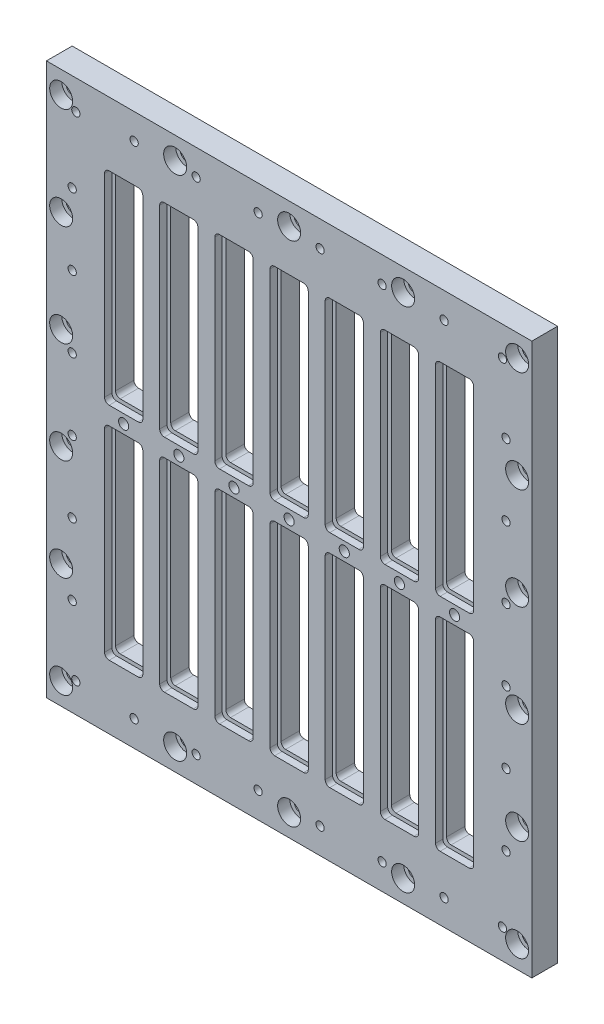
from build123d import *

# Parameters (mm, degrees)
FLANGE_W                         = 167.64
FLANGE_H                         = 190.5
PLATE_DEPTH                      = 8.89
SKETCH3_W                        = 13.208
SKETCH3_H                        = 70.104
RECESS_DEPTH                     = 2.54
SKETCH5_W                        = 10.668
SKETCH5_H                        = 67.564
THRU_HOLE_DEPTH                  = 128.038094287
FILLET2_R                        = 1.5875
FILLET2_OF_MIRROR1_R             = 1.5875
F_6_32_TAPPED_HOLE1_AT_2_COUNT   = 2
F_6_32_TAPPED_HOLE1_AT_2_PITCH   = 211.263499003
CONNECTOR_PAT_DEPTH              = 8.89
CONNECTOR_START                  = 6.35
CONNECTOR_PAT_2_DEPTH            = 2.54
CBORE_D                          = 4.9149
CBORE_CBORE_D                    = 7.9375
CBORE_CBORE_DEPTH                = 4.1656
CBORE_PATTERN_V_COUNT            = 6
CBORE_PATTERN_V_PITCH            = 35.052
CBORE_PATTERN_H_COUNT            = 5
CBORE_PATTERN_H_PITCH            = 39.37
F_4_40_H_PAT_COUNT               = 6
F_4_40_H_PAT_PITCH               = 21.408571429
F_4_40_V_PAT_COUNT               = 6
F_4_40_V_PAT_PITCH               = 24.674285714
F_4_40_TAPPED_CORNERS_AT_2_COUNT = 2
F_4_40_TAPPED_CORNERS_AT_2_PITCH = 170.18
MIRROR2_COPY_1_D                 = 4.9149
MIRROR2_COPY_1_CBORE_D           = 7.9375
MIRROR2_COPY_1_CBORE_DEPTH       = 4.1656
MIRROR2_COPY_2_D                 = 4.9149
MIRROR2_COPY_2_CBORE_D           = 7.9375
MIRROR2_COPY_2_CBORE_DEPTH       = 4.1656
MIRROR2_COPY_3_D                 = 4.9149
MIRROR2_COPY_3_CBORE_D           = 7.9375
MIRROR2_COPY_3_CBORE_DEPTH       = 4.1656
MIRROR2_COPY_4_D                 = 4.9149
MIRROR2_COPY_4_CBORE_D           = 7.9375
MIRROR2_COPY_4_CBORE_DEPTH       = 4.1656
MIRROR2_COPY_5_D                 = 4.9149
MIRROR2_COPY_5_CBORE_D           = 7.9375
MIRROR2_COPY_5_CBORE_DEPTH       = 4.1656
MIRROR3_COPY_1_D                 = 4.9149
MIRROR3_COPY_1_CBORE_D           = 7.9375
MIRROR3_COPY_1_CBORE_DEPTH       = 4.1656
MIRROR3_COPY_2_D                 = 4.9149
MIRROR3_COPY_2_CBORE_D           = 7.9375
MIRROR3_COPY_2_CBORE_DEPTH       = 4.1656
MIRROR3_COPY_3_D                 = 4.9149
MIRROR3_COPY_3_CBORE_D           = 7.9375
MIRROR3_COPY_3_CBORE_DEPTH       = 4.1656
MIRROR3_COPY_4_D                 = 4.9149
MIRROR3_COPY_4_CBORE_D           = 7.9375
MIRROR3_COPY_4_CBORE_DEPTH       = 4.1656
MIRROR3_COPY_5_D                 = 4.9149
MIRROR3_COPY_5_CBORE_D           = 7.9375
MIRROR3_COPY_5_CBORE_DEPTH       = 4.1656
MIRROR3_COPY_6_D                 = 4.9149
MIRROR3_COPY_6_CBORE_D           = 7.9375
MIRROR3_COPY_6_CBORE_DEPTH       = 4.1656
ORING_RECESS_DEPTH               = 2.6416
RF_W                             = 148.9964
RF_H                             = 170.7896
RF_RECESS_DEPTH                  = 1.1938


# Read off the part's stored shape, not the designer's step: connector pat
with BuildPart() as part:
    # flange → plate (new body)
    with BuildSketch(Plane.XY):
        Rectangle(FLANGE_W, FLANGE_H)
    extrude(amount=PLATE_DEPTH)

    # Sketch3 → recess (cut)
    with BuildSketch(Plane.XY.offset(8.89)):
        with Locations((0, -38.1381)):
            Rectangle(SKETCH3_W, SKETCH3_H)
    recess = extrude(amount=-RECESS_DEPTH, mode=Mode.SUBTRACT)

    # Sketch5 → thru hole (cut, through all)
    with BuildSketch(Plane.XY.offset(6.35)):
        with Locations((0, -38.1381)):
            Rectangle(SKETCH5_W, SKETCH5_H)
    thru_hole = extrude(amount=-THRU_HOLE_DEPTH, mode=Mode.SUBTRACT)

    # Fillet2
    fillet2_edges = [part.edges().sort_by_distance(p)[0] for p in [
        (-6.604, -73.1901, 7.62),
        (-6.604, -3.0861, 7.62),
        (6.604, -3.0861, 7.62),
        (6.604, -73.1901, 7.62),
        (-5.334, -4.3561, 3.175),
        (5.334, -4.3561, 3.175),
        (5.334, -71.9201, 3.175),
        (-5.334, -71.9201, 3.175),
    ]]
    fillet(fillet2_edges, radius=FILLET2_R)

    # Mirror1: recess, thru hole across plane
    add(recess.mirror(Plane.ZX), mode=Mode.SUBTRACT)
    add(thru_hole.mirror(Plane.ZX), mode=Mode.SUBTRACT)

    # Fillet2 of Mirror1
    fillet2_of_mirror1_edges = [part.edges().sort_by_distance(p)[0] for p in [
        (-6.604, 73.1901, 7.62),
        (-6.604, 3.0861, 7.62),
        (6.604, 3.0861, 7.62),
        (6.604, 73.1901, 7.62),
        (-5.334, 4.3561, 3.175),
        (5.334, 4.3561, 3.175),
        (5.334, 71.9201, 3.175),
        (-5.334, 71.9201, 3.175),
    ]]
    fillet(fillet2_of_mirror1_edges, radius=FILLET2_OF_MIRROR1_R)

    # Sketch10 → #6-32 Tapped Hole1 (revolve, cut)
    with BuildSketch(Plane(origin=(0, 0, 8.89), x_dir=(0, -1, 0), z_dir=(1, 0, 0))):
        Polygon((0, 0), (0, 7.16269403), (1.35255, 6.35), (1.35255, 5.08), (1.7526, 5.08), (1.7526, 0), align=None)
    f_6_32_tapped_hole1 = revolve(axis=Axis((0, 0, 15.24), (0, 0, -1)), mode=Mode.SUBTRACT)

    # #6-32 Tapped Hole1 at 2: #6-32 Tapped Hole1 ×2
    with Locations(*[Vector(-0.9956457663100188, -0.09321753069533449, 0) * (i * F_6_32_TAPPED_HOLE1_AT_2_PITCH) for i in range(1, F_6_32_TAPPED_HOLE1_AT_2_COUNT)]):
        add(f_6_32_tapped_hole1, mode=Mode.SUBTRACT)

    # connector pat outline → connector pat (cut)
    with BuildSketch(Plane.XY):
        with BuildLine():
            ThreePointArc((-13.716, -5.9436), (-14.180967985, -4.821067985), (-15.3035, -4.3561))
            Line((-15.3035, -4.3561), (-22.7965, -4.3561))
            ThreePointArc((-22.7965, -4.3561), (-23.919032015, -4.821067985), (-24.384, -5.9436))
            Line((-24.384, -5.9436), (-24.384, -70.3326))
            ThreePointArc((-24.384, -70.3326), (-23.919032015, -71.455132015), (-22.7965, -71.9201))
            Line((-22.7965, -71.9201), (-15.3035, -71.9201))
            ThreePointArc((-15.3035, -71.9201), (-14.180967985, -71.455132015), (-13.716, -70.3326))
            Line((-13.716, -70.3326), (-13.716, -5.9436))
        make_face()
        with BuildLine():
            ThreePointArc((-32.766, -5.9436), (-33.230967985, -4.821067985), (-34.3535, -4.3561))
            Line((-34.3535, -4.3561), (-41.8465, -4.3561))
            ThreePointArc((-41.8465, -4.3561), (-42.969032015, -4.821067985), (-43.434, -5.9436))
            Line((-43.434, -5.9436), (-43.434, -70.3326))
            ThreePointArc((-43.434, -70.3326), (-42.969032015, -71.455132015), (-41.8465, -71.9201))
            Line((-41.8465, -71.9201), (-34.3535, -71.9201))
            ThreePointArc((-34.3535, -71.9201), (-33.230967985, -71.455132015), (-32.766, -70.3326))
            Line((-32.766, -70.3326), (-32.766, -5.9436))
        make_face()
        with BuildLine():
            ThreePointArc((-51.816, -5.9436), (-52.280967985, -4.821067985), (-53.4035, -4.3561))
            Line((-53.4035, -4.3561), (-60.8965, -4.3561))
            ThreePointArc((-60.8965, -4.3561), (-62.019032015, -4.821067985), (-62.484, -5.9436))
            Line((-62.484, -5.9436), (-62.484, -70.3326))
            ThreePointArc((-62.484, -70.3326), (-62.019032015, -71.455132015), (-60.8965, -71.9201))
            Line((-60.8965, -71.9201), (-53.4035, -71.9201))
            ThreePointArc((-53.4035, -71.9201), (-52.280967985, -71.455132015), (-51.816, -70.3326))
            Line((-51.816, -70.3326), (-51.816, -5.9436))
        make_face()
        with BuildLine():
            ThreePointArc((24.384, -5.9436), (23.919032015, -4.821067985), (22.7965, -4.3561))
            Line((22.7965, -4.3561), (15.3035, -4.3561))
            ThreePointArc((15.3035, -4.3561), (14.180967985, -4.821067985), (13.716, -5.9436))
            Line((13.716, -5.9436), (13.716, -70.3326))
            ThreePointArc((13.716, -70.3326), (14.180967985, -71.455132015), (15.3035, -71.9201))
            Line((15.3035, -71.9201), (22.7965, -71.9201))
            ThreePointArc((22.7965, -71.9201), (23.919032015, -71.455132015), (24.384, -70.3326))
            Line((24.384, -70.3326), (24.384, -5.9436))
        make_face()
        with BuildLine():
            ThreePointArc((43.434, -5.9436), (42.969032015, -4.821067985), (41.8465, -4.3561))
            Line((41.8465, -4.3561), (34.3535, -4.3561))
            ThreePointArc((34.3535, -4.3561), (33.230967985, -4.821067985), (32.766, -5.9436))
            Line((32.766, -5.9436), (32.766, -70.3326))
            ThreePointArc((32.766, -70.3326), (33.230967985, -71.455132015), (34.3535, -71.9201))
            Line((34.3535, -71.9201), (41.8465, -71.9201))
            ThreePointArc((41.8465, -71.9201), (42.969032015, -71.455132015), (43.434, -70.3326))
            Line((43.434, -70.3326), (43.434, -5.9436))
        make_face()
        with BuildLine():
            ThreePointArc((62.484, -5.9436), (62.019032015, -4.821067985), (60.8965, -4.3561))
            Line((60.8965, -4.3561), (53.4035, -4.3561))
            ThreePointArc((53.4035, -4.3561), (52.280967985, -4.821067985), (51.816, -5.9436))
            Line((51.816, -5.9436), (51.816, -70.3326))
            ThreePointArc((51.816, -70.3326), (52.280967985, -71.455132015), (53.4035, -71.9201))
            Line((53.4035, -71.9201), (60.8965, -71.9201))
            ThreePointArc((60.8965, -71.9201), (62.019032015, -71.455132015), (62.484, -70.3326))
            Line((62.484, -70.3326), (62.484, -5.9436))
        make_face()
        with BuildLine():
            ThreePointArc((-13.716, 70.3326), (-14.180967985, 71.455132015), (-15.3035, 71.9201))
            Line((-15.3035, 71.9201), (-22.7965, 71.9201))
            ThreePointArc((-22.7965, 71.9201), (-23.919032015, 71.455132015), (-24.384, 70.3326))
            Line((-24.384, 70.3326), (-24.384, 5.9436))
            ThreePointArc((-24.384, 5.9436), (-23.919032015, 4.821067985), (-22.7965, 4.3561))
            Line((-22.7965, 4.3561), (-15.3035, 4.3561))
            ThreePointArc((-15.3035, 4.3561), (-14.180967985, 4.821067985), (-13.716, 5.9436))
            Line((-13.716, 5.9436), (-13.716, 70.3326))
        make_face()
        with BuildLine():
            ThreePointArc((-32.766, 70.3326), (-33.230967985, 71.455132015), (-34.3535, 71.9201))
            Line((-34.3535, 71.9201), (-41.8465, 71.9201))
            ThreePointArc((-41.8465, 71.9201), (-42.969032015, 71.455132015), (-43.434, 70.3326))
            Line((-43.434, 70.3326), (-43.434, 5.9436))
            ThreePointArc((-43.434, 5.9436), (-42.969032015, 4.821067985), (-41.8465, 4.3561))
            Line((-41.8465, 4.3561), (-34.3535, 4.3561))
            ThreePointArc((-34.3535, 4.3561), (-33.230967985, 4.821067985), (-32.766, 5.9436))
            Line((-32.766, 5.9436), (-32.766, 70.3326))
        make_face()
        with BuildLine():
            ThreePointArc((-51.816, 70.3326), (-52.280967985, 71.455132015), (-53.4035, 71.9201))
            Line((-53.4035, 71.9201), (-60.8965, 71.9201))
            ThreePointArc((-60.8965, 71.9201), (-62.019032015, 71.455132015), (-62.484, 70.3326))
            Line((-62.484, 70.3326), (-62.484, 5.9436))
            ThreePointArc((-62.484, 5.9436), (-62.019032015, 4.821067985), (-60.8965, 4.3561))
            Line((-60.8965, 4.3561), (-53.4035, 4.3561))
            ThreePointArc((-53.4035, 4.3561), (-52.280967985, 4.821067985), (-51.816, 5.9436))
            Line((-51.816, 5.9436), (-51.816, 70.3326))
        make_face()
        with BuildLine():
            ThreePointArc((24.384, 70.3326), (23.919032015, 71.455132015), (22.7965, 71.9201))
            Line((22.7965, 71.9201), (15.3035, 71.9201))
            ThreePointArc((15.3035, 71.9201), (14.180967985, 71.455132015), (13.716, 70.3326))
            Line((13.716, 70.3326), (13.716, 5.9436))
            ThreePointArc((13.716, 5.9436), (14.180967985, 4.821067985), (15.3035, 4.3561))
            Line((15.3035, 4.3561), (22.7965, 4.3561))
            ThreePointArc((22.7965, 4.3561), (23.919032015, 4.821067985), (24.384, 5.9436))
            Line((24.384, 5.9436), (24.384, 70.3326))
        make_face()
        with BuildLine():
            ThreePointArc((43.434, 70.3326), (42.969032015, 71.455132015), (41.8465, 71.9201))
            Line((41.8465, 71.9201), (34.3535, 71.9201))
            ThreePointArc((34.3535, 71.9201), (33.230967985, 71.455132015), (32.766, 70.3326))
            Line((32.766, 70.3326), (32.766, 5.9436))
            ThreePointArc((32.766, 5.9436), (33.230967985, 4.821067985), (34.3535, 4.3561))
            Line((34.3535, 4.3561), (41.8465, 4.3561))
            ThreePointArc((41.8465, 4.3561), (42.969032015, 4.821067985), (43.434, 5.9436))
            Line((43.434, 5.9436), (43.434, 70.3326))
        make_face()
        with BuildLine():
            ThreePointArc((62.484, 70.3326), (62.019032015, 71.455132015), (60.8965, 71.9201))
            Line((60.8965, 71.9201), (53.4035, 71.9201))
            ThreePointArc((53.4035, 71.9201), (52.280967985, 71.455132015), (51.816, 70.3326))
            Line((51.816, 70.3326), (51.816, 5.9436))
            ThreePointArc((51.816, 5.9436), (52.280967985, 4.821067985), (53.4035, 4.3561))
            Line((53.4035, 4.3561), (60.8965, 4.3561))
            ThreePointArc((60.8965, 4.3561), (62.019032015, 4.821067985), (62.484, 5.9436))
            Line((62.484, 5.9436), (62.484, 70.3326))
        make_face()
    extrude(amount=CONNECTOR_PAT_DEPTH, mode=Mode.SUBTRACT)

    # connector pat 2 outline → connector pat 2 (cut)
    # profile 1 of 12: a face of its own
    with BuildSketch(Plane.XY.offset(CONNECTOR_START)):
        with BuildLine():
            ThreePointArc((-12.446, -4.6736), (-12.910967985, -3.551067985), (-14.0335, -3.0861))
            Line((-14.0335, -3.0861), (-24.0665, -3.0861))
            ThreePointArc((-24.0665, -3.0861), (-25.189032015, -3.551067985), (-25.654, -4.6736))
            Line((-25.654, -4.6736), (-25.654, -71.6026))
            ThreePointArc((-25.654, -71.6026), (-25.189032015, -72.725132015), (-24.0665, -73.1901))
            Line((-24.0665, -73.1901), (-14.0335, -73.1901))
            ThreePointArc((-14.0335, -73.1901), (-12.910967985, -72.725132015), (-12.446, -71.6026))
            Line((-12.446, -71.6026), (-12.446, -4.6736))
        make_face()
        with BuildLine():
            Line((-22.7965, -4.3561), (-15.3035, -4.3561))
            ThreePointArc((-15.3035, -4.3561), (-14.180967985, -4.821067985), (-13.716, -5.9436))
            Line((-13.716, -5.9436), (-13.716, -70.3326))
            ThreePointArc((-13.716, -70.3326), (-14.180967985, -71.455132015), (-15.3035, -71.9201))
            Line((-15.3035, -71.9201), (-22.7965, -71.9201))
            ThreePointArc((-22.7965, -71.9201), (-23.919032015, -71.455132015), (-24.384, -70.3326))
            Line((-24.384, -70.3326), (-24.384, -5.9436))
            ThreePointArc((-24.384, -5.9436), (-23.919032015, -4.821067985), (-22.7965, -4.3561))
        make_face(mode=Mode.SUBTRACT)
    # profile 2 of 12: a face of its own
    with BuildSketch(Plane.XY.offset(CONNECTOR_START)):
        with BuildLine():
            ThreePointArc((-31.496, -4.6736), (-31.960967985, -3.551067985), (-33.0835, -3.0861))
            Line((-33.0835, -3.0861), (-43.1165, -3.0861))
            ThreePointArc((-43.1165, -3.0861), (-44.239032015, -3.551067985), (-44.704, -4.6736))
            Line((-44.704, -4.6736), (-44.704, -71.6026))
            ThreePointArc((-44.704, -71.6026), (-44.239032015, -72.725132015), (-43.1165, -73.1901))
            Line((-43.1165, -73.1901), (-33.0835, -73.1901))
            ThreePointArc((-33.0835, -73.1901), (-31.960967985, -72.725132015), (-31.496, -71.6026))
            Line((-31.496, -71.6026), (-31.496, -4.6736))
        make_face()
        with BuildLine():
            Line((-41.8465, -4.3561), (-34.3535, -4.3561))
            ThreePointArc((-34.3535, -4.3561), (-33.230967985, -4.821067985), (-32.766, -5.9436))
            Line((-32.766, -5.9436), (-32.766, -70.3326))
            ThreePointArc((-32.766, -70.3326), (-33.230967985, -71.455132015), (-34.3535, -71.9201))
            Line((-34.3535, -71.9201), (-41.8465, -71.9201))
            ThreePointArc((-41.8465, -71.9201), (-42.969032015, -71.455132015), (-43.434, -70.3326))
            Line((-43.434, -70.3326), (-43.434, -5.9436))
            ThreePointArc((-43.434, -5.9436), (-42.969032015, -4.821067985), (-41.8465, -4.3561))
        make_face(mode=Mode.SUBTRACT)
    # profile 3 of 12: a face of its own
    with BuildSketch(Plane.XY.offset(CONNECTOR_START)):
        with BuildLine():
            ThreePointArc((-50.546, -4.6736), (-51.010967985, -3.551067985), (-52.1335, -3.0861))
            Line((-52.1335, -3.0861), (-62.1665, -3.0861))
            ThreePointArc((-62.1665, -3.0861), (-63.289032015, -3.551067985), (-63.754, -4.6736))
            Line((-63.754, -4.6736), (-63.754, -71.6026))
            ThreePointArc((-63.754, -71.6026), (-63.289032015, -72.725132015), (-62.1665, -73.1901))
            Line((-62.1665, -73.1901), (-52.1335, -73.1901))
            ThreePointArc((-52.1335, -73.1901), (-51.010967985, -72.725132015), (-50.546, -71.6026))
            Line((-50.546, -71.6026), (-50.546, -4.6736))
        make_face()
        with BuildLine():
            Line((-60.8965, -4.3561), (-53.4035, -4.3561))
            ThreePointArc((-53.4035, -4.3561), (-52.280967985, -4.821067985), (-51.816, -5.9436))
            Line((-51.816, -5.9436), (-51.816, -70.3326))
            ThreePointArc((-51.816, -70.3326), (-52.280967985, -71.455132015), (-53.4035, -71.9201))
            Line((-53.4035, -71.9201), (-60.8965, -71.9201))
            ThreePointArc((-60.8965, -71.9201), (-62.019032015, -71.455132015), (-62.484, -70.3326))
            Line((-62.484, -70.3326), (-62.484, -5.9436))
            ThreePointArc((-62.484, -5.9436), (-62.019032015, -4.821067985), (-60.8965, -4.3561))
        make_face(mode=Mode.SUBTRACT)
    # profile 4 of 12: a face of its own
    with BuildSketch(Plane.XY.offset(CONNECTOR_START)):
        with BuildLine():
            ThreePointArc((25.654, -4.6736), (25.189032015, -3.551067985), (24.0665, -3.0861))
            Line((24.0665, -3.0861), (14.0335, -3.0861))
            ThreePointArc((14.0335, -3.0861), (12.910967985, -3.551067985), (12.446, -4.6736))
            Line((12.446, -4.6736), (12.446, -71.6026))
            ThreePointArc((12.446, -71.6026), (12.910967985, -72.725132015), (14.0335, -73.1901))
            Line((14.0335, -73.1901), (24.0665, -73.1901))
            ThreePointArc((24.0665, -73.1901), (25.189032015, -72.725132015), (25.654, -71.6026))
            Line((25.654, -71.6026), (25.654, -4.6736))
        make_face()
        with BuildLine():
            Line((15.3035, -4.3561), (22.7965, -4.3561))
            ThreePointArc((22.7965, -4.3561), (23.919032015, -4.821067985), (24.384, -5.9436))
            Line((24.384, -5.9436), (24.384, -70.3326))
            ThreePointArc((24.384, -70.3326), (23.919032015, -71.455132015), (22.7965, -71.9201))
            Line((22.7965, -71.9201), (15.3035, -71.9201))
            ThreePointArc((15.3035, -71.9201), (14.180967985, -71.455132015), (13.716, -70.3326))
            Line((13.716, -70.3326), (13.716, -5.9436))
            ThreePointArc((13.716, -5.9436), (14.180967985, -4.821067985), (15.3035, -4.3561))
        make_face(mode=Mode.SUBTRACT)
    # profile 5 of 12: a face of its own
    with BuildSketch(Plane.XY.offset(CONNECTOR_START)):
        with BuildLine():
            ThreePointArc((44.704, -4.6736), (44.239032015, -3.551067985), (43.1165, -3.0861))
            Line((43.1165, -3.0861), (33.0835, -3.0861))
            ThreePointArc((33.0835, -3.0861), (31.960967985, -3.551067985), (31.496, -4.6736))
            Line((31.496, -4.6736), (31.496, -71.6026))
            ThreePointArc((31.496, -71.6026), (31.960967985, -72.725132015), (33.0835, -73.1901))
            Line((33.0835, -73.1901), (43.1165, -73.1901))
            ThreePointArc((43.1165, -73.1901), (44.239032015, -72.725132015), (44.704, -71.6026))
            Line((44.704, -71.6026), (44.704, -4.6736))
        make_face()
        with BuildLine():
            Line((34.3535, -4.3561), (41.8465, -4.3561))
            ThreePointArc((41.8465, -4.3561), (42.969032015, -4.821067985), (43.434, -5.9436))
            Line((43.434, -5.9436), (43.434, -70.3326))
            ThreePointArc((43.434, -70.3326), (42.969032015, -71.455132015), (41.8465, -71.9201))
            Line((41.8465, -71.9201), (34.3535, -71.9201))
            ThreePointArc((34.3535, -71.9201), (33.230967985, -71.455132015), (32.766, -70.3326))
            Line((32.766, -70.3326), (32.766, -5.9436))
            ThreePointArc((32.766, -5.9436), (33.230967985, -4.821067985), (34.3535, -4.3561))
        make_face(mode=Mode.SUBTRACT)
    # profile 6 of 12: a face of its own
    with BuildSketch(Plane.XY.offset(CONNECTOR_START)):
        with BuildLine():
            ThreePointArc((63.754, -4.6736), (63.289032015, -3.551067985), (62.1665, -3.0861))
            Line((62.1665, -3.0861), (52.1335, -3.0861))
            ThreePointArc((52.1335, -3.0861), (51.010967985, -3.551067985), (50.546, -4.6736))
            Line((50.546, -4.6736), (50.546, -71.6026))
            ThreePointArc((50.546, -71.6026), (51.010967985, -72.725132015), (52.1335, -73.1901))
            Line((52.1335, -73.1901), (62.1665, -73.1901))
            ThreePointArc((62.1665, -73.1901), (63.289032015, -72.725132015), (63.754, -71.6026))
            Line((63.754, -71.6026), (63.754, -4.6736))
        make_face()
        with BuildLine():
            Line((53.4035, -4.3561), (60.8965, -4.3561))
            ThreePointArc((60.8965, -4.3561), (62.019032015, -4.821067985), (62.484, -5.9436))
            Line((62.484, -5.9436), (62.484, -70.3326))
            ThreePointArc((62.484, -70.3326), (62.019032015, -71.455132015), (60.8965, -71.9201))
            Line((60.8965, -71.9201), (53.4035, -71.9201))
            ThreePointArc((53.4035, -71.9201), (52.280967985, -71.455132015), (51.816, -70.3326))
            Line((51.816, -70.3326), (51.816, -5.9436))
            ThreePointArc((51.816, -5.9436), (52.280967985, -4.821067985), (53.4035, -4.3561))
        make_face(mode=Mode.SUBTRACT)
    # profile 7 of 12: a face of its own
    with BuildSketch(Plane.XY.offset(CONNECTOR_START)):
        with BuildLine():
            ThreePointArc((-12.446, 71.6026), (-12.910967985, 72.725132015), (-14.0335, 73.1901))
            Line((-14.0335, 73.1901), (-24.0665, 73.1901))
            ThreePointArc((-24.0665, 73.1901), (-25.189032015, 72.725132015), (-25.654, 71.6026))
            Line((-25.654, 71.6026), (-25.654, 4.6736))
            ThreePointArc((-25.654, 4.6736), (-25.189032015, 3.551067985), (-24.0665, 3.0861))
            Line((-24.0665, 3.0861), (-14.0335, 3.0861))
            ThreePointArc((-14.0335, 3.0861), (-12.910967985, 3.551067985), (-12.446, 4.6736))
            Line((-12.446, 4.6736), (-12.446, 71.6026))
        make_face()
        with BuildLine():
            Line((-22.7965, 71.9201), (-15.3035, 71.9201))
            ThreePointArc((-15.3035, 71.9201), (-14.180967985, 71.455132015), (-13.716, 70.3326))
            Line((-13.716, 70.3326), (-13.716, 5.9436))
            ThreePointArc((-13.716, 5.9436), (-14.180967985, 4.821067985), (-15.3035, 4.3561))
            Line((-15.3035, 4.3561), (-22.7965, 4.3561))
            ThreePointArc((-22.7965, 4.3561), (-23.919032015, 4.821067985), (-24.384, 5.9436))
            Line((-24.384, 5.9436), (-24.384, 70.3326))
            ThreePointArc((-24.384, 70.3326), (-23.919032015, 71.455132015), (-22.7965, 71.9201))
        make_face(mode=Mode.SUBTRACT)
    # profile 8 of 12: a face of its own
    with BuildSketch(Plane.XY.offset(CONNECTOR_START)):
        with BuildLine():
            ThreePointArc((-31.496, 71.6026), (-31.960967985, 72.725132015), (-33.0835, 73.1901))
            Line((-33.0835, 73.1901), (-43.1165, 73.1901))
            ThreePointArc((-43.1165, 73.1901), (-44.239032015, 72.725132015), (-44.704, 71.6026))
            Line((-44.704, 71.6026), (-44.704, 4.6736))
            ThreePointArc((-44.704, 4.6736), (-44.239032015, 3.551067985), (-43.1165, 3.0861))
            Line((-43.1165, 3.0861), (-33.0835, 3.0861))
            ThreePointArc((-33.0835, 3.0861), (-31.960967985, 3.551067985), (-31.496, 4.6736))
            Line((-31.496, 4.6736), (-31.496, 71.6026))
        make_face()
        with BuildLine():
            Line((-41.8465, 71.9201), (-34.3535, 71.9201))
            ThreePointArc((-34.3535, 71.9201), (-33.230967985, 71.455132015), (-32.766, 70.3326))
            Line((-32.766, 70.3326), (-32.766, 5.9436))
            ThreePointArc((-32.766, 5.9436), (-33.230967985, 4.821067985), (-34.3535, 4.3561))
            Line((-34.3535, 4.3561), (-41.8465, 4.3561))
            ThreePointArc((-41.8465, 4.3561), (-42.969032015, 4.821067985), (-43.434, 5.9436))
            Line((-43.434, 5.9436), (-43.434, 70.3326))
            ThreePointArc((-43.434, 70.3326), (-42.969032015, 71.455132015), (-41.8465, 71.9201))
        make_face(mode=Mode.SUBTRACT)
    # profile 9 of 12: a face of its own
    with BuildSketch(Plane.XY.offset(CONNECTOR_START)):
        with BuildLine():
            ThreePointArc((-50.546, 71.6026), (-51.010967985, 72.725132015), (-52.1335, 73.1901))
            Line((-52.1335, 73.1901), (-62.1665, 73.1901))
            ThreePointArc((-62.1665, 73.1901), (-63.289032015, 72.725132015), (-63.754, 71.6026))
            Line((-63.754, 71.6026), (-63.754, 4.6736))
            ThreePointArc((-63.754, 4.6736), (-63.289032015, 3.551067985), (-62.1665, 3.0861))
            Line((-62.1665, 3.0861), (-52.1335, 3.0861))
            ThreePointArc((-52.1335, 3.0861), (-51.010967985, 3.551067985), (-50.546, 4.6736))
            Line((-50.546, 4.6736), (-50.546, 71.6026))
        make_face()
        with BuildLine():
            Line((-60.8965, 71.9201), (-53.4035, 71.9201))
            ThreePointArc((-53.4035, 71.9201), (-52.280967985, 71.455132015), (-51.816, 70.3326))
            Line((-51.816, 70.3326), (-51.816, 5.9436))
            ThreePointArc((-51.816, 5.9436), (-52.280967985, 4.821067985), (-53.4035, 4.3561))
            Line((-53.4035, 4.3561), (-60.8965, 4.3561))
            ThreePointArc((-60.8965, 4.3561), (-62.019032015, 4.821067985), (-62.484, 5.9436))
            Line((-62.484, 5.9436), (-62.484, 70.3326))
            ThreePointArc((-62.484, 70.3326), (-62.019032015, 71.455132015), (-60.8965, 71.9201))
        make_face(mode=Mode.SUBTRACT)
    # profile 10 of 12: a face of its own
    with BuildSketch(Plane.XY.offset(CONNECTOR_START)):
        with BuildLine():
            ThreePointArc((25.654, 71.6026), (25.189032015, 72.725132015), (24.0665, 73.1901))
            Line((24.0665, 73.1901), (14.0335, 73.1901))
            ThreePointArc((14.0335, 73.1901), (12.910967985, 72.725132015), (12.446, 71.6026))
            Line((12.446, 71.6026), (12.446, 4.6736))
            ThreePointArc((12.446, 4.6736), (12.910967985, 3.551067985), (14.0335, 3.0861))
            Line((14.0335, 3.0861), (24.0665, 3.0861))
            ThreePointArc((24.0665, 3.0861), (25.189032015, 3.551067985), (25.654, 4.6736))
            Line((25.654, 4.6736), (25.654, 71.6026))
        make_face()
        with BuildLine():
            Line((15.3035, 71.9201), (22.7965, 71.9201))
            ThreePointArc((22.7965, 71.9201), (23.919032015, 71.455132015), (24.384, 70.3326))
            Line((24.384, 70.3326), (24.384, 5.9436))
            ThreePointArc((24.384, 5.9436), (23.919032015, 4.821067985), (22.7965, 4.3561))
            Line((22.7965, 4.3561), (15.3035, 4.3561))
            ThreePointArc((15.3035, 4.3561), (14.180967985, 4.821067985), (13.716, 5.9436))
            Line((13.716, 5.9436), (13.716, 70.3326))
            ThreePointArc((13.716, 70.3326), (14.180967985, 71.455132015), (15.3035, 71.9201))
        make_face(mode=Mode.SUBTRACT)
    # profile 11 of 12: a face of its own
    with BuildSketch(Plane.XY.offset(CONNECTOR_START)):
        with BuildLine():
            ThreePointArc((44.704, 71.6026), (44.239032015, 72.725132015), (43.1165, 73.1901))
            Line((43.1165, 73.1901), (33.0835, 73.1901))
            ThreePointArc((33.0835, 73.1901), (31.960967985, 72.725132015), (31.496, 71.6026))
            Line((31.496, 71.6026), (31.496, 4.6736))
            ThreePointArc((31.496, 4.6736), (31.960967985, 3.551067985), (33.0835, 3.0861))
            Line((33.0835, 3.0861), (43.1165, 3.0861))
            ThreePointArc((43.1165, 3.0861), (44.239032015, 3.551067985), (44.704, 4.6736))
            Line((44.704, 4.6736), (44.704, 71.6026))
        make_face()
        with BuildLine():
            Line((34.3535, 71.9201), (41.8465, 71.9201))
            ThreePointArc((41.8465, 71.9201), (42.969032015, 71.455132015), (43.434, 70.3326))
            Line((43.434, 70.3326), (43.434, 5.9436))
            ThreePointArc((43.434, 5.9436), (42.969032015, 4.821067985), (41.8465, 4.3561))
            Line((41.8465, 4.3561), (34.3535, 4.3561))
            ThreePointArc((34.3535, 4.3561), (33.230967985, 4.821067985), (32.766, 5.9436))
            Line((32.766, 5.9436), (32.766, 70.3326))
            ThreePointArc((32.766, 70.3326), (33.230967985, 71.455132015), (34.3535, 71.9201))
        make_face(mode=Mode.SUBTRACT)
    # profile 12 of 12: a face of its own
    with BuildSketch(Plane.XY.offset(CONNECTOR_START)):
        with BuildLine():
            ThreePointArc((63.754, 71.6026), (63.289032015, 72.725132015), (62.1665, 73.1901))
            Line((62.1665, 73.1901), (52.1335, 73.1901))
            ThreePointArc((52.1335, 73.1901), (51.010967985, 72.725132015), (50.546, 71.6026))
            Line((50.546, 71.6026), (50.546, 4.6736))
            ThreePointArc((50.546, 4.6736), (51.010967985, 3.551067985), (52.1335, 3.0861))
            Line((52.1335, 3.0861), (62.1665, 3.0861))
            ThreePointArc((62.1665, 3.0861), (63.289032015, 3.551067985), (63.754, 4.6736))
            Line((63.754, 4.6736), (63.754, 71.6026))
        make_face()
        with BuildLine():
            Line((53.4035, 71.9201), (60.8965, 71.9201))
            ThreePointArc((60.8965, 71.9201), (62.019032015, 71.455132015), (62.484, 70.3326))
            Line((62.484, 70.3326), (62.484, 5.9436))
            ThreePointArc((62.484, 5.9436), (62.019032015, 4.821067985), (60.8965, 4.3561))
            Line((60.8965, 4.3561), (53.4035, 4.3561))
            ThreePointArc((53.4035, 4.3561), (52.280967985, 4.821067985), (51.816, 5.9436))
            Line((51.816, 5.9436), (51.816, 70.3326))
            ThreePointArc((51.816, 70.3326), (52.280967985, 71.455132015), (53.4035, 71.9201))
        make_face(mode=Mode.SUBTRACT)
    extrude(amount=CONNECTOR_PAT_2_DEPTH, mode=Mode.SUBTRACT)

    # connector pat 3 outline → connector pat 3 (revolve, cut)
    with BuildSketch(Plane(origin=(-19.05, 0, 0), x_dir=(1, 0, 0), z_dir=(0, -1, 0))):
        Polygon((1.7526, 8.89), (0, 8.89), (0, 1.72730597), (1.35255, 2.54), (1.35255, 3.81), (1.7526, 3.81), align=None)
    revolve(axis=Axis((-19.05, 0, 0), (0, 0, 1)), mode=Mode.SUBTRACT)

    # connector pat 4 outline → connector pat 4 (revolve, cut)
    with BuildSketch(Plane(origin=(-38.1, 0, 0), x_dir=(1, 0, 0), z_dir=(0, -1, 0))):
        Polygon((1.7526, 8.89), (0, 8.89), (0, 1.72730597), (1.35255, 2.54), (1.35255, 3.81), (1.7526, 3.81), align=None)
    revolve(axis=Axis((-38.1, 0, 0), (0, 0, 1)), mode=Mode.SUBTRACT)

    # connector pat 5 outline → connector pat 5 (revolve, cut)
    with BuildSketch(Plane(origin=(-57.15, 0, 0), x_dir=(1, 0, 0), z_dir=(0, -1, 0))):
        Polygon((1.7526, 8.89), (0, 8.89), (0, 1.72730597), (1.35255, 2.54), (1.35255, 3.81), (1.7526, 3.81), align=None)
    revolve(axis=Axis((-57.15, 0, 0), (0, 0, 1)), mode=Mode.SUBTRACT)

    # connector pat 6 outline → connector pat 6 (revolve, cut)
    with BuildSketch(Plane(origin=(19.05, 0, 0), x_dir=(1, 0, 0), z_dir=(0, -1, 0))):
        Polygon((1.7526, 8.89), (0, 8.89), (0, 1.72730597), (1.35255, 2.54), (1.35255, 3.81), (1.7526, 3.81), align=None)
    revolve(axis=Axis((19.05, 0, 0), (0, 0, 1)), mode=Mode.SUBTRACT)

    # connector pat 7 outline → connector pat 7 (revolve, cut)
    with BuildSketch(Plane(origin=(38.1, 0, 0), x_dir=(1, 0, 0), z_dir=(0, -1, 0))):
        Polygon((1.7526, 8.89), (0, 8.89), (0, 1.72730597), (1.35255, 2.54), (1.35255, 3.81), (1.7526, 3.81), align=None)
    revolve(axis=Axis((38.1, 0, 0), (0, 0, 1)), mode=Mode.SUBTRACT)

    # connector pat 8 outline → connector pat 8 (revolve, cut)
    with BuildSketch(Plane(origin=(57.15, 0, 0), x_dir=(1, 0, 0), z_dir=(0, -1, 0))):
        Polygon((1.7526, 8.89), (0, 8.89), (0, 1.72730597), (1.35255, 2.54), (1.35255, 3.81), (1.7526, 3.81), align=None)
    revolve(axis=Axis((57.15, 0, 0), (0, 0, 1)), mode=Mode.SUBTRACT)

    # CBORE (through all)
    with Locations(Plane(origin=(-78.74, -87.63, 8.89), x_dir=(1, 0, 0), z_dir=(0, 0, 1))):
        with Locations((0, 0)):
            cbore = CounterBoreHole(CBORE_D / 2, CBORE_CBORE_D / 2, CBORE_CBORE_DEPTH)

    # CBORE pattern V: CBORE ×6
    with Locations(*[(0, i * CBORE_PATTERN_V_PITCH, 0) for i in range(1, CBORE_PATTERN_V_COUNT)]):
        add(cbore, mode=Mode.SUBTRACT)

    # CBORE pattern H: CBORE ×5
    with Locations(*[(i * CBORE_PATTERN_H_PITCH, 0, 0) for i in range(1, CBORE_PATTERN_H_COUNT)]):
        add(cbore, mode=Mode.SUBTRACT)

    # Sketch16 → #4-40 Tapped H (revolve, cut)
    with BuildSketch(Plane(origin=(-53.521428571, -86.36, 8.89), x_dir=(0, -1, 0), z_dir=(1, 0, 0))):
        Polygon((0, 0), (0, 7.029152758), (1.1303, 6.35), (1.1303, 5.08), (1.4224, 5.08), (1.4224, 0), align=None)
    f_4_40_tapped_h = revolve(axis=Axis((-53.521428571, -86.36, 15.24), (0, 0, -1)), mode=Mode.SUBTRACT)

    # 4-40 H pat: #4-40 Tapped H ×6
    with Locations(*[(i * F_4_40_H_PAT_PITCH, 0, 0) for i in range(1, F_4_40_H_PAT_COUNT)]):
        add(f_4_40_tapped_h, mode=Mode.SUBTRACT)

    # Sketch19 → #4-40 Tapped V (revolve, cut)
    with BuildSketch(Plane(origin=(-74.93, -61.685714286, 8.89), x_dir=(0, -1, 0), z_dir=(1, 0, 0))):
        Polygon((0, 0), (0, 5.759152758), (1.1303, 5.08), (1.1303, 4.445), (1.4224, 4.445), (1.4224, 0), align=None)
    f_4_40_tapped_v = revolve(axis=Axis((-74.93, -61.685714286, 15.24), (0, 0, -1)), mode=Mode.SUBTRACT)

    # 4-40 V pat: #4-40 Tapped V ×6
    with Locations(*[(0, i * F_4_40_V_PAT_PITCH, 0) for i in range(1, F_4_40_V_PAT_COUNT)]):
        add(f_4_40_tapped_v, mode=Mode.SUBTRACT)

    # Sketch20 → #4-40 Tapped Corners (revolve, cut)
    with BuildSketch(Plane(origin=(-73.66, 85.09, 8.89), x_dir=(0, -1, 0), z_dir=(1, 0, 0))):
        Polygon((0, 0), (0, 7.029152758), (1.1303, 6.35), (1.1303, 5.08), (1.4224, 5.08), (1.4224, 0), align=None)
    f_4_40_tapped_corners = revolve(axis=Axis((-73.66, 85.09, 15.24), (0, 0, -1)), mode=Mode.SUBTRACT)

    # #4-40 Tapped Corners at 2: #4-40 Tapped Corners ×2
    with Locations(*[(0, -i * F_4_40_TAPPED_CORNERS_AT_2_PITCH, 0) for i in range(1, F_4_40_TAPPED_CORNERS_AT_2_COUNT)]):
        add(f_4_40_tapped_corners, mode=Mode.SUBTRACT)

    # Mirror2: #4-40 Tapped H across plane
    add(f_4_40_tapped_h.mirror(Plane.ZX), mode=Mode.SUBTRACT)

    # Mirror2 copy 1 (through all)
    with Locations(Plane(origin=(-39.37, 87.63, 8.89), x_dir=(1, 0, 0), z_dir=(0, 0, 1))):
        with Locations((0, 0)):
            CounterBoreHole(MIRROR2_COPY_1_D / 2, MIRROR2_COPY_1_CBORE_D / 2, MIRROR2_COPY_1_CBORE_DEPTH)

    # Mirror2 copy 2 (through all)
    with Locations(Plane(origin=(0, 87.63, 8.89), x_dir=(1, 0, 0), z_dir=(0, 0, 1))):
        with Locations((0, 0)):
            CounterBoreHole(MIRROR2_COPY_2_D / 2, MIRROR2_COPY_2_CBORE_D / 2, MIRROR2_COPY_2_CBORE_DEPTH)

    # Mirror2 copy 3 (through all)
    with Locations(Plane(origin=(39.37, 87.63, 8.89), x_dir=(1, 0, 0), z_dir=(0, 0, 1))):
        with Locations((0, 0)):
            CounterBoreHole(MIRROR2_COPY_3_D / 2, MIRROR2_COPY_3_CBORE_D / 2, MIRROR2_COPY_3_CBORE_DEPTH)

    # Mirror2 copy 4 (through all)
    with Locations(Plane(origin=(78.74, 87.63, 8.89), x_dir=(1, 0, 0), z_dir=(0, 0, 1))):
        with Locations((0, 0)):
            CounterBoreHole(MIRROR2_COPY_4_D / 2, MIRROR2_COPY_4_CBORE_D / 2, MIRROR2_COPY_4_CBORE_DEPTH)

    # Mirror2 copy 5 (through all)
    with Locations(Plane(origin=(-78.74, 87.63, 8.89), x_dir=(1, 0, 0), z_dir=(0, 0, 1))):
        with Locations((0, 0)):
            CounterBoreHole(MIRROR2_COPY_5_D / 2, MIRROR2_COPY_5_CBORE_D / 2, MIRROR2_COPY_5_CBORE_DEPTH)

    # Mirror2 copy 6 sketch → Mirror2 copy 6 (revolve, cut)
    with BuildSketch(Plane(origin=(-32.112857143, 86.36, 8.89), x_dir=(0, 1, 0), z_dir=(1, 0, 0))):
        Polygon((0, 0), (0, -7.029152758), (1.1303, -6.35), (1.1303, -5.08), (1.4224, -5.08), (1.4224, 0), align=None)
    revolve(axis=Axis((-32.112857143, 86.36, 15.24), (0, 0, 1)), mode=Mode.SUBTRACT)

    # Mirror2 copy 7 sketch → Mirror2 copy 7 (revolve, cut)
    with BuildSketch(Plane(origin=(-10.704285714, 86.36, 8.89), x_dir=(0, 1, 0), z_dir=(1, 0, 0))):
        Polygon((0, 0), (0, -7.029152758), (1.1303, -6.35), (1.1303, -5.08), (1.4224, -5.08), (1.4224, 0), align=None)
    revolve(axis=Axis((-10.704285714, 86.36, 15.24), (0, 0, 1)), mode=Mode.SUBTRACT)

    # Mirror2 copy 8 sketch → Mirror2 copy 8 (revolve, cut)
    with BuildSketch(Plane(origin=(10.704285714, 86.36, 8.89), x_dir=(0, 1, 0), z_dir=(1, 0, 0))):
        Polygon((0, 0), (0, -7.029152758), (1.1303, -6.35), (1.1303, -5.08), (1.4224, -5.08), (1.4224, 0), align=None)
    revolve(axis=Axis((10.704285714, 86.36, 15.24), (0, 0, 1)), mode=Mode.SUBTRACT)

    # Mirror2 copy 9 sketch → Mirror2 copy 9 (revolve, cut)
    with BuildSketch(Plane(origin=(32.112857143, 86.36, 8.89), x_dir=(0, 1, 0), z_dir=(1, 0, 0))):
        Polygon((0, 0), (0, -7.029152758), (1.1303, -6.35), (1.1303, -5.08), (1.4224, -5.08), (1.4224, 0), align=None)
    revolve(axis=Axis((32.112857143, 86.36, 15.24), (0, 0, 1)), mode=Mode.SUBTRACT)

    # Mirror2 copy 10 sketch → Mirror2 copy 10 (revolve, cut)
    with BuildSketch(Plane(origin=(53.521428571, 86.36, 8.89), x_dir=(0, 1, 0), z_dir=(1, 0, 0))):
        Polygon((0, 0), (0, -7.029152758), (1.1303, -6.35), (1.1303, -5.08), (1.4224, -5.08), (1.4224, 0), align=None)
    revolve(axis=Axis((53.521428571, 86.36, 15.24), (0, 0, 1)), mode=Mode.SUBTRACT)

    # Mirror3: #4-40 Tapped V, #4-40 Tapped Corners across plane
    add(f_4_40_tapped_v.mirror(Plane(origin=(0, 0, 0), x_dir=(0, 0, 1), z_dir=(1, 0, 0))), mode=Mode.SUBTRACT)
    add(f_4_40_tapped_corners.mirror(Plane(origin=(0, 0, 0), x_dir=(0, 0, 1), z_dir=(1, 0, 0))), mode=Mode.SUBTRACT)

    # Mirror3 copy 1 (through all)
    with Locations(Plane(origin=(78.74, -52.578, 8.89), x_dir=(-1, 0, 0), z_dir=(0, 0, 1))):
        with Locations((0, 0)):
            CounterBoreHole(MIRROR3_COPY_1_D / 2, MIRROR3_COPY_1_CBORE_D / 2, MIRROR3_COPY_1_CBORE_DEPTH)

    # Mirror3 copy 2 (through all)
    with Locations(Plane(origin=(78.74, -17.526, 8.89), x_dir=(-1, 0, 0), z_dir=(0, 0, 1))):
        with Locations((0, 0)):
            CounterBoreHole(MIRROR3_COPY_2_D / 2, MIRROR3_COPY_2_CBORE_D / 2, MIRROR3_COPY_2_CBORE_DEPTH)

    # Mirror3 copy 3 (through all)
    with Locations(Plane(origin=(78.74, 17.526, 8.89), x_dir=(-1, 0, 0), z_dir=(0, 0, 1))):
        with Locations((0, 0)):
            CounterBoreHole(MIRROR3_COPY_3_D / 2, MIRROR3_COPY_3_CBORE_D / 2, MIRROR3_COPY_3_CBORE_DEPTH)

    # Mirror3 copy 4 (through all)
    with Locations(Plane(origin=(78.74, 52.578, 8.89), x_dir=(-1, 0, 0), z_dir=(0, 0, 1))):
        with Locations((0, 0)):
            CounterBoreHole(MIRROR3_COPY_4_D / 2, MIRROR3_COPY_4_CBORE_D / 2, MIRROR3_COPY_4_CBORE_DEPTH)

    # Mirror3 copy 5 (through all)
    with Locations(Plane(origin=(78.74, 87.63, 8.89), x_dir=(-1, 0, 0), z_dir=(0, 0, 1))):
        with Locations((0, 0)):
            CounterBoreHole(MIRROR3_COPY_5_D / 2, MIRROR3_COPY_5_CBORE_D / 2, MIRROR3_COPY_5_CBORE_DEPTH)

    # Mirror3 copy 6 (through all)
    with Locations(Plane(origin=(78.74, -87.63, 8.89), x_dir=(-1, 0, 0), z_dir=(0, 0, 1))):
        with Locations((0, 0)):
            CounterBoreHole(MIRROR3_COPY_6_D / 2, MIRROR3_COPY_6_CBORE_D / 2, MIRROR3_COPY_6_CBORE_DEPTH)

    # Mirror3 copy 7 sketch → Mirror3 copy 7 (revolve, cut)
    with BuildSketch(Plane(origin=(74.93, -37.011428571, 8.89), x_dir=(0, -1, 0), z_dir=(-1, 0, 0))):
        Polygon((0, 0), (0, -5.759152758), (1.1303, -5.08), (1.1303, -4.445), (1.4224, -4.445), (1.4224, 0), align=None)
    revolve(axis=Axis((74.93, -37.011428571, 15.24), (0, 0, 1)), mode=Mode.SUBTRACT)

    # Mirror3 copy 8 sketch → Mirror3 copy 8 (revolve, cut)
    with BuildSketch(Plane(origin=(74.93, -12.337142857, 8.89), x_dir=(0, -1, 0), z_dir=(-1, 0, 0))):
        Polygon((0, 0), (0, -5.759152758), (1.1303, -5.08), (1.1303, -4.445), (1.4224, -4.445), (1.4224, 0), align=None)
    revolve(axis=Axis((74.93, -12.337142857, 15.24), (0, 0, 1)), mode=Mode.SUBTRACT)

    # Mirror3 copy 9 sketch → Mirror3 copy 9 (revolve, cut)
    with BuildSketch(Plane(origin=(74.93, 12.337142857, 8.89), x_dir=(0, -1, 0), z_dir=(-1, 0, 0))):
        Polygon((0, 0), (0, -5.759152758), (1.1303, -5.08), (1.1303, -4.445), (1.4224, -4.445), (1.4224, 0), align=None)
    revolve(axis=Axis((74.93, 12.337142857, 15.24), (0, 0, 1)), mode=Mode.SUBTRACT)

    # Mirror3 copy 10 sketch → Mirror3 copy 10 (revolve, cut)
    with BuildSketch(Plane(origin=(74.93, 37.011428571, 8.89), x_dir=(0, -1, 0), z_dir=(-1, 0, 0))):
        Polygon((0, 0), (0, -5.759152758), (1.1303, -5.08), (1.1303, -4.445), (1.4224, -4.445), (1.4224, 0), align=None)
    revolve(axis=Axis((74.93, 37.011428571, 15.24), (0, 0, 1)), mode=Mode.SUBTRACT)

    # Mirror3 copy 11 sketch → Mirror3 copy 11 (revolve, cut)
    with BuildSketch(Plane(origin=(74.93, 61.685714286, 8.89), x_dir=(0, -1, 0), z_dir=(-1, 0, 0))):
        Polygon((0, 0), (0, -5.759152758), (1.1303, -5.08), (1.1303, -4.445), (1.4224, -4.445), (1.4224, 0), align=None)
    revolve(axis=Axis((74.93, 61.685714286, 15.24), (0, 0, 1)), mode=Mode.SUBTRACT)

    # Mirror3 copy 12 sketch → Mirror3 copy 12 (revolve, cut)
    with BuildSketch(Plane(origin=(73.66, -85.09, 8.89), x_dir=(0, -1, 0), z_dir=(-1, 0, 0))):
        Polygon((0, 0), (0, -7.029152758), (1.1303, -6.35), (1.1303, -5.08), (1.4224, -5.08), (1.4224, 0), align=None)
    revolve(axis=Axis((73.66, -85.09, 15.24), (0, 0, 1)), mode=Mode.SUBTRACT)

    # oring → oring recess (cut)
    with BuildSketch(Plane(origin=(0, 0, 0), x_dir=(-1, 0, 0), z_dir=(0, 0, -1))):
        with BuildLine():
            Line((-70.799680102, -65.786), (-70.799680102, 65.786))
            ThreePointArc((-70.799680102, 65.786), (-65.852420743, 77.729740641), (-53.908680102, 82.677))
            Line((-53.908680102, 82.677), (53.908680102, 82.677))
            ThreePointArc((53.908680102, 82.677), (65.852420743, 77.729740641), (70.799680102, 65.786))
            Line((70.799680102, 65.786), (70.799680102, -65.786))
            ThreePointArc((70.799680102, -65.786), (65.852420743, -77.729740641), (53.908680102, -82.677))
            Line((53.908680102, -82.677), (-53.908680102, -82.677))
            ThreePointArc((-53.908680102, -82.677), (-65.852420743, -77.729740641), (-70.799680102, -65.786))
        make_face()
        with BuildLine():
            Line((-66.608680102, -65.786), (-66.608680102, 65.786))
            ThreePointArc((-66.608680102, 65.786), (-62.888936223, 74.766256121), (-53.908680102, 78.486))
            Line((-53.908680102, 78.486), (53.908680102, 78.486))
            ThreePointArc((53.908680102, 78.486), (62.888936223, 74.766256121), (66.608680102, 65.786))
            Line((66.608680102, 65.786), (66.608680102, -65.786))
            ThreePointArc((66.608680102, -65.786), (62.888936223, -74.766256121), (53.908680102, -78.486))
            Line((53.908680102, -78.486), (-53.908680102, -78.486))
            ThreePointArc((-53.908680102, -78.486), (-62.888936223, -74.766256121), (-66.608680102, -65.786))
        make_face(mode=Mode.SUBTRACT)
    extrude(amount=-ORING_RECESS_DEPTH, mode=Mode.SUBTRACT)

    # rf → rf recess (cut)
    with BuildSketch(Plane(origin=(0, 0, 0), x_dir=(-1, 0, 0), z_dir=(0, 0, -1))):
        with BuildLine():
            Line((80.9752, 88.6968), (80.9752, -88.6968))
            ThreePointArc((80.9752, -88.6968), (80.04526403, -90.94186403), (77.8002, -91.8718))
            Line((77.8002, -91.8718), (-77.8002, -91.8718))
            ThreePointArc((-77.8002, -91.8718), (-80.04526403, -90.94186403), (-80.9752, -88.6968))
            Line((-80.9752, -88.6968), (-80.9752, 88.6968))
            ThreePointArc((-80.9752, 88.6968), (-80.04526403, 90.94186403), (-77.8002, 91.8718))
            Line((-77.8002, 91.8718), (77.8002, 91.8718))
            ThreePointArc((77.8002, 91.8718), (80.04526403, 90.94186403), (80.9752, 88.6968))
        make_face()
        Rectangle(RF_W, RF_H, mode=Mode.SUBTRACT)
    extrude(amount=-RF_RECESS_DEPTH, mode=Mode.SUBTRACT)


solid = part.part
